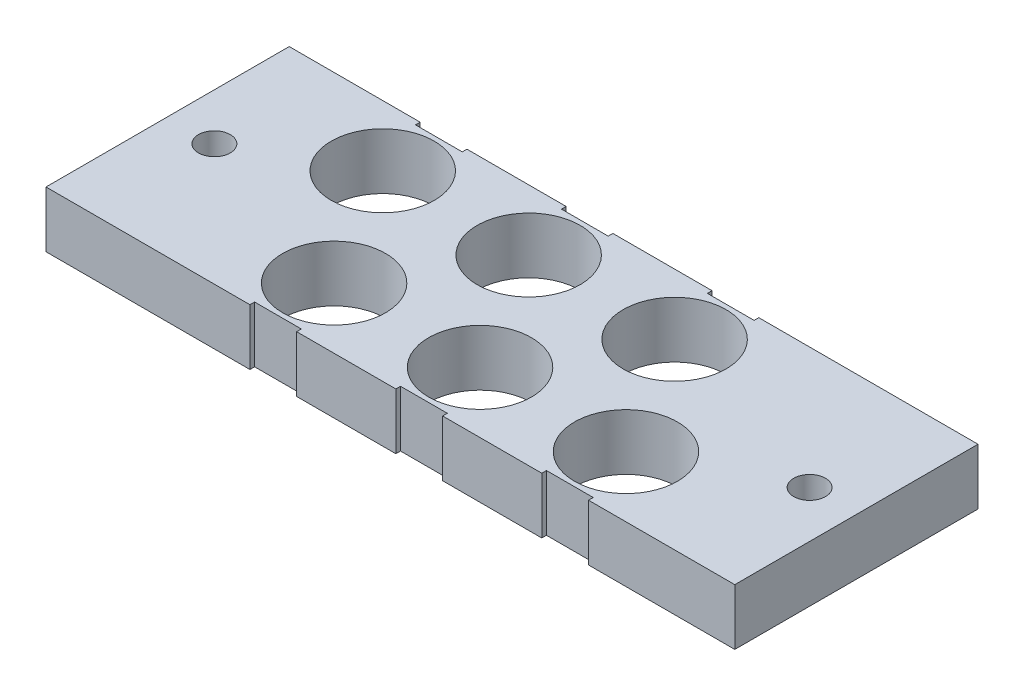
from build123d import *

# Parameters (mm, degrees)
SKETCH1_W             = 12
SKETCH1_H             = 12
SKETCH1_R             = 5.5
BOSS_EXTRUDE1_DEPTH   = 6
BOSS_EXTRUDE1_2_DEPTH = 6
BOSS_EXTRUDE1_3_DEPTH = 6
BOSS_EXTRUDE1_4_DEPTH = 6
BOSS_EXTRUDE1_5_DEPTH = 6
BOSS_EXTRUDE1_6_DEPTH = 6
SKETCH1_3_R           = 1.7
BOSS_EXTRUDE2_DEPTH   = 6
CUT_EXTRUDE1_DEPTH    = 1


with BuildPart() as part:
    # Sketch1 → Boss-Extrude1 (new body)
    with BuildSketch(Plane(origin=(0, 0, 0), x_dir=(1, 0, 0), z_dir=(0, 1, 0))):
        with Locations((-2.713611414, -10.664883528)):
            Rectangle(SKETCH1_W, SKETCH1_H)
        with Locations((-2.713611414, -10.664883528)):
            Circle(SKETCH1_R, mode=Mode.SUBTRACT)
    extrude(amount=-BOSS_EXTRUDE1_DEPTH)



with BuildPart() as body_2:
    # Sketch1 → Boss-Extrude1 2 (new body)
    with BuildSketch(Plane(origin=(0, 0, 0), x_dir=(1, 0, 0), z_dir=(0, 1, 0))):
        with Locations((12.886388586, -10.664882884)):
            Rectangle(SKETCH1_W, SKETCH1_H)
        with Locations((12.886388586, -10.664882884)):
            Circle(SKETCH1_R, mode=Mode.SUBTRACT)
    extrude(amount=-BOSS_EXTRUDE1_2_DEPTH)


with BuildPart() as body_3:
    # Sketch1 → Boss-Extrude1 3 (new body)
    with BuildSketch(Plane(origin=(0, 0, 0), x_dir=(1, 0, 0), z_dir=(0, 1, 0))):
        with Locations((5.086388588, -23.66488245)):
            Rectangle(SKETCH1_W, SKETCH1_H)
        with Locations((5.086388588, -23.66488245)):
            Circle(SKETCH1_R, mode=Mode.SUBTRACT)
    extrude(amount=-BOSS_EXTRUDE1_3_DEPTH)


with BuildPart() as body_4:
    # Sketch1 → Boss-Extrude1 4 (new body)
    with BuildSketch(Plane(origin=(0, 0, 0), x_dir=(1, 0, 0), z_dir=(0, 1, 0))):
        with Locations((20.686388588, -23.664882884)):
            Rectangle(SKETCH1_W, SKETCH1_H)
        with Locations((20.686388588, -23.664882884)):
            Circle(SKETCH1_R, mode=Mode.SUBTRACT)
    extrude(amount=-BOSS_EXTRUDE1_4_DEPTH)


with BuildPart() as body_5:
    # Sketch1 → Boss-Extrude1 5 (new body)
    with BuildSketch(Plane(origin=(0, 0, 0), x_dir=(1, 0, 0), z_dir=(0, 1, 0))):
        with Locations((28.486388586, -10.664882884)):
            Rectangle(SKETCH1_W, SKETCH1_H)
        with Locations((28.486388586, -10.664882884)):
            Circle(SKETCH1_R, mode=Mode.SUBTRACT)
    extrude(amount=-BOSS_EXTRUDE1_5_DEPTH)


with BuildPart() as body_6:
    # Sketch1 → Boss-Extrude1 6 (new body)
    with BuildSketch(Plane(origin=(0, 0, 0), x_dir=(1, 0, 0), z_dir=(0, 1, 0))):
        with Locations((36.286388588, -23.664883087)):
            Rectangle(SKETCH1_W, SKETCH1_H)
        with Locations((36.286388588, -23.664883087)):
            Circle(SKETCH1_R, mode=Mode.SUBTRACT)
    extrude(amount=-BOSS_EXTRUDE1_6_DEPTH)


with BuildPart() as part_1:
    add(part.part)

    add(body_2.part)  # Boss-Extrude2 merges body 2

    add(body_3.part)  # Boss-Extrude2 merges body 3

    add(body_4.part)  # Boss-Extrude2 merges body 4

    add(body_5.part)  # Boss-Extrude2 merges body 5

    add(body_6.part)  # Boss-Extrude2 merges body 6
    # Sketch1<3> → Boss-Extrude2 (add)
    with BuildSketch(Plane(origin=(0, 0, 0), x_dir=(1, 0, 0), z_dir=(0, 1, 0))):
        Polygon((6.386388586, -4.164882884), (3.786388586, -4.164883528), (-0.213611414, -4.164883528), (-0.213611414, -4.664883528), (3.286388586, -4.664883528), (3.286388586, -16.664883528), (-8.713611414, -16.664883528), (-8.713611414, -4.664883528), (-5.213611414, -4.664883528), (-5.213611414, -4.164883528), (-19.213611414, -4.164883528), (-19.213611414, -30.16488245), (2.586388588, -30.16488245), (2.586388588, -29.66488245), (-0.913611412, -29.66488245), (-0.913611412, -17.66488245), (11.086388588, -17.66488245), (11.086388588, -29.66488245), (7.586388588, -29.66488245), (7.586388588, -30.16488245), (11.586388588, -30.16488245), (14.186388588, -30.164882884), (18.186388588, -30.164882884), (18.186388588, -29.664882884), (14.686388588, -29.664882884), (14.686388588, -17.664882884), (26.686388588, -17.664882884), (26.686388588, -29.664882884), (23.186388588, -29.664882884), (23.186388588, -30.164882884), (27.186388588, -30.164882884), (29.786388588, -30.164883087), (33.786388588, -30.164883087), (33.786388588, -29.664883087), (30.286388588, -29.664883087), (30.286388588, -17.664883087), (42.286388588, -17.664883087), (42.286388588, -29.664883087), (38.786388588, -29.664883087), (38.786388588, -30.164883087), (42.786388588, -30.164883087), (54.418988347, -30.16488245), (54.418988347, -4.164883528), (34.986388586, -4.164882884), (30.986388586, -4.164882884), (30.986388586, -4.664882884), (34.486388586, -4.664882884), (34.486388586, -16.664882884), (22.486388586, -16.664882884), (22.486388586, -4.664882884), (25.986388586, -4.664882884), (25.986388586, -4.164882884), (15.386388586, -4.164882884), (15.386388586, -4.664882884), (18.886388586, -4.664882884), (18.886388586, -16.664882884), (6.886388586, -16.664882884), (6.886388586, -4.664882884), (10.386388586, -4.664882884), (10.386388586, -4.164882884), align=None)
        with Locations((-14.213611414, -17.164882989)):
            Circle(SKETCH1_3_R, mode=Mode.SUBTRACT)
        with Locations((49.418988347, -17.164882989)):
            Circle(SKETCH1_3_R, mode=Mode.SUBTRACT)
    extrude(amount=-BOSS_EXTRUDE2_DEPTH)

    # Sketch2 → Cut-Extrude1 (cut)
    with BuildSketch(Plane(origin=(0, -6, 0), x_dir=(-1, 0, 0), z_dir=(0, -1, 0))):
        Polygon((6.798219501, -22.292392997), (8.345014372, -22.292392997), (8.345014372, -22.618034023), (7.083155398, -22.618034023), (7.083155398, -23.5949571), (8.345014372, -23.5949571), (8.345014372, -23.920598125), (7.083155398, -23.920598125), (7.083155398, -25.467392997), (6.798219501, -25.467392997), align=None)
        with BuildLine():
            Line((10.624501552, -22.292392997), (10.624501552, -22.618034023))
            Line((10.624501552, -22.618034023), (9.545179637, -22.618034023))
            Line((9.545179637, -22.618034023), (9.373454877, -23.453125169))
            add(Edge.make_bspline(
                [(9.373454877, -23.453125169), (9.407069849, -23.443844851), (9.47219354, -23.425865702), (9.568314271, -23.405903325), (9.65956577, -23.393869672), (9.718779856, -23.392226555), (9.747433243, -23.391431459)],
                knots=[0, 0, 0, 0, 1.100273476, 2.13160584, 3.095893838, 4, 4, 4, 4], degree=3))
            add(Edge.make_bspline(
                [(9.747433243, -23.391431459), (9.782887778, -23.392198843), (9.852600253, -23.393707713), (9.95459844, -23.408196462), (10.051964708, -23.431001956), (10.144495429, -23.462861287), (10.232361786, -23.50360083), (10.314755359, -23.55449149), (10.392912895, -23.613939584), (10.465432248, -23.682288273), (10.531222156, -23.757510025), (10.589067018, -23.838388951), (10.638200225, -23.924139045), (10.677716053, -24.015579597), (10.709270413, -24.111699686), (10.73027258, -24.213510672), (10.744257737, -24.320052895), (10.745820188, -24.392900612), (10.746616936, -24.430048246)],
                knots=[0, 0, 0, 0, 1.052922333, 2.070308379, 3.05430497, 4.020497103, 4.973039431, 5.925935799, 6.892292201, 7.88610001, 8.88166317, 9.857072816, 10.836096531, 11.812156883, 12.81219415, 13.836441305, 14.89672472, 16, 16, 16, 16], degree=3))
            add(Edge.make_bspline(
                [(10.746616936, -24.430048246), (10.746013618, -24.455921974), (10.744815135, -24.50731977), (10.738720416, -24.583650581), (10.726985874, -24.658365436), (10.711230867, -24.731474249), (10.690781673, -24.802838608), (10.666026603, -24.87266278), (10.635731635, -24.940512173), (10.602501745, -25.007028781), (10.565085297, -25.070708856), (10.523557651, -25.130261865), (10.479683241, -25.186581177), (10.43247427, -25.239062778), (10.381491939, -25.287361801), (10.327353683, -25.331764885), (10.270491502, -25.373022949), (10.210025675, -25.409461241), (10.147303566, -25.442991922), (10.081419397, -25.470499703), (10.013872905, -25.495092824), (9.94369191, -25.514695753), (9.87103538, -25.530055999), (9.795783548, -25.540488687), (9.718331083, -25.548087312), (9.665830179, -25.548562979), (9.639310246, -25.548803254)],
                knots=[0, 0, 0, 0, 1.056347294, 2.098418968, 3.122841568, 4.141288669, 5.149314143, 6.15115421, 7.162517403, 8.180376062, 9.185164535, 10.17417709, 11.141909838, 12.097768115, 13.052685741, 14.0056014, 14.954263652, 15.917497458, 16.885230207, 17.854509472, 18.828990115, 19.81800267, 20.826176721, 21.857883937, 22.917946725, 24, 24, 24, 24], degree=3))
            add(Edge.make_bspline(
                [(9.639310246, -25.548803254), (9.607674382, -25.548176565), (9.545434557, -25.546943629), (9.454248042, -25.534045431), (9.366514079, -25.51557245), (9.282938915, -25.487780977), (9.202773555, -25.452958217), (9.127097232, -25.408947118), (9.053976278, -25.359073217), (8.986383216, -25.300217468), (8.923648742, -25.235886814), (8.867490695, -25.166075239), (8.817476664, -25.09193496), (8.774407565, -25.01310592), (8.737670075, -24.929795253), (8.708809335, -24.841690816), (8.685515399, -24.749252955), (8.675660725, -24.685613699), (8.670655398, -24.653290433)],
                knots=[0, 0, 0, 0, 1.0467383, 2.05933395, 3.04377827, 4.011590433, 4.970194871, 5.932262533, 6.905835911, 7.896367577, 8.894135286, 9.877477877, 10.858688626, 11.851381753, 12.8477658, 13.868841284, 14.917554742, 16, 16, 16, 16], degree=3))
            Line((8.670655398, -24.653290433), (8.955591295, -24.653290433))
            add(Edge.make_bspline(
                [(8.955591295, -24.653290433), (8.962602201, -24.683567644), (8.976077551, -24.741762123), (9.005655623, -24.823524126), (9.041819667, -24.896385136), (9.084822183, -24.961308972), (9.13612114, -25.017922848), (9.19465855, -25.068375469), (9.26028827, -25.113891479), (9.333216414, -25.151830703), (9.410153993, -25.184187358), (9.490678534, -25.205733539), (9.572597477, -25.220883634), (9.628004284, -25.22240016), (9.655846704, -25.223162228)],
                knots=[0, 0, 0, 0, 1.136247022, 2.183929868, 3.172523383, 4.106158343, 5.02341133, 5.958108904, 6.928429099, 7.938127109, 8.96079061, 9.975095812, 10.982467395, 12, 12, 12, 12], degree=3))
            add(Edge.make_bspline(
                [(9.655846704, -25.223162228), (9.683023293, -25.222417665), (9.736534219, -25.220951615), (9.815284548, -25.209667654), (9.891314798, -25.192289), (9.963874758, -25.166281346), (10.034234154, -25.134672208), (10.100613217, -25.094109247), (10.164932256, -25.047427659), (10.225192063, -24.993945573), (10.280382135, -24.935008778), (10.329146616, -24.871982857), (10.369765673, -24.804748289), (10.4039959, -24.734469072), (10.429988536, -24.660374952), (10.448531426, -24.582813172), (10.459419915, -24.501592154), (10.460917771, -24.446193566), (10.461681039, -24.417963911)],
                knots=[0, 0, 0, 0, 1.027316725, 2.022795036, 3.002884548, 3.971462791, 4.93288096, 5.914575861, 6.907176829, 7.935150275, 8.956128384, 9.956726525, 10.942570165, 11.921478529, 12.907843606, 13.90538589, 14.932640048, 16, 16, 16, 16], degree=3))
            add(Edge.make_bspline(
                [(10.461681039, -24.417963911), (10.461083704, -24.392495193), (10.459914506, -24.342643802), (10.450361774, -24.269710237), (10.433745664, -24.20070112), (10.410682573, -24.135283207), (10.381400448, -24.073394799), (10.345617007, -24.014972023), (10.302660711, -23.960784903), (10.25359164, -23.910808086), (10.199836132, -23.864684521), (10.140469308, -23.825365243), (10.076733517, -23.79228726), (10.009396666, -23.76374129), (9.93685708, -23.743239186), (9.860551277, -23.72784689), (9.779655264, -23.718942953), (9.72434614, -23.717707526), (9.695915815, -23.717072484)],
                knots=[0, 0, 0, 0, 1.045622112, 2.046656509, 3.013763289, 3.955457236, 4.890082067, 5.820317437, 6.762574623, 7.722996705, 8.69280354, 9.665887285, 10.63943826, 11.638615906, 12.663482002, 13.728887084, 14.832589034, 16, 16, 16, 16], degree=3))
            add(Edge.make_bspline(
                [(9.695915815, -23.717072484), (9.671306001, -23.717599164), (9.620492978, -23.718686622), (9.5425487, -23.726693516), (9.460641208, -23.73961059), (9.375084487, -23.757378115), (9.285621598, -23.780629163), (9.192441334, -23.808491603), (9.095347778, -23.841803701), (9.0299267, -23.866960781), (8.996296424, -23.879892997)],
                knots=[0, 0, 0, 0, 0.817624296, 1.688186739, 2.600797293, 3.572016777, 4.590301741, 5.671205678, 6.80286297, 8, 8, 8, 8], degree=3))
            Line((8.996296424, -23.879892997), (9.321937449, -22.292392997))
            Line((9.321937449, -22.292392997), (10.624501552, -22.292392997))
        make_face()
    extrude(amount=-CUT_EXTRUDE1_DEPTH, mode=Mode.SUBTRACT)


solid = part_1.part
